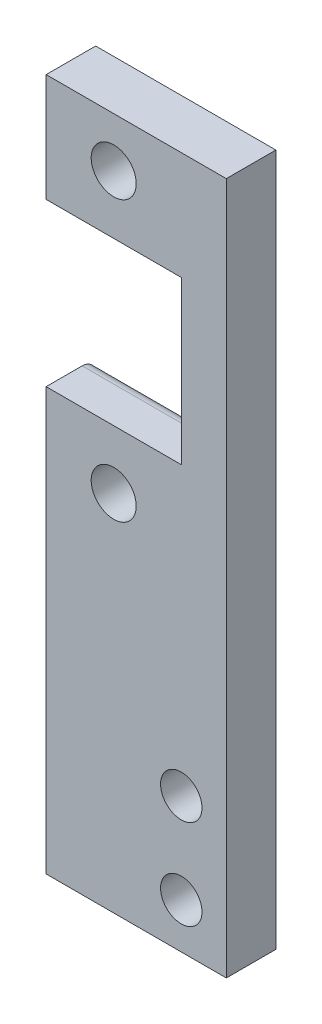
from build123d import *

# Parameters (mm, degrees)
PROFILESKETCH3_R           = 2.5
PROFILESKETCH3_R_2         = 2.3
PROFILEBOSS_EXTRUDE1_DEPTH = 5.5
FILLET1_R                  = 1.5


with BuildPart() as part:
    # ProfileSketch3 → ProfileBoss-Extrude1 (new body)
    with BuildSketch(Plane.XY):
        Polygon((0, 46.85), (15, 46.85), (15, 64.85), (0, 64.85), (0, 76.85), (20, 76.85), (20, 0), (0, 0), align=None)
        with Locations((7.5, 40.35)):
            Circle(PROFILESKETCH3_R, mode=Mode.SUBTRACT)
        with Locations((7.5, 71.35)):
            Circle(PROFILESKETCH3_R, mode=Mode.SUBTRACT)
        with Locations((15, 15)):
            Circle(PROFILESKETCH3_R_2, mode=Mode.SUBTRACT)
        with Locations((15, 5)):
            Circle(PROFILESKETCH3_R_2, mode=Mode.SUBTRACT)
    extrude(amount=PROFILEBOSS_EXTRUDE1_DEPTH)

    # Fillet1
    fillet1_edges = [part.edges().sort_by_distance(p)[0] for p in [
        (7.5, 46.85, 0),
        (7.5, 64.85, 0),
    ]]
    fillet(fillet1_edges, radius=FILLET1_R)


solid = part.part
